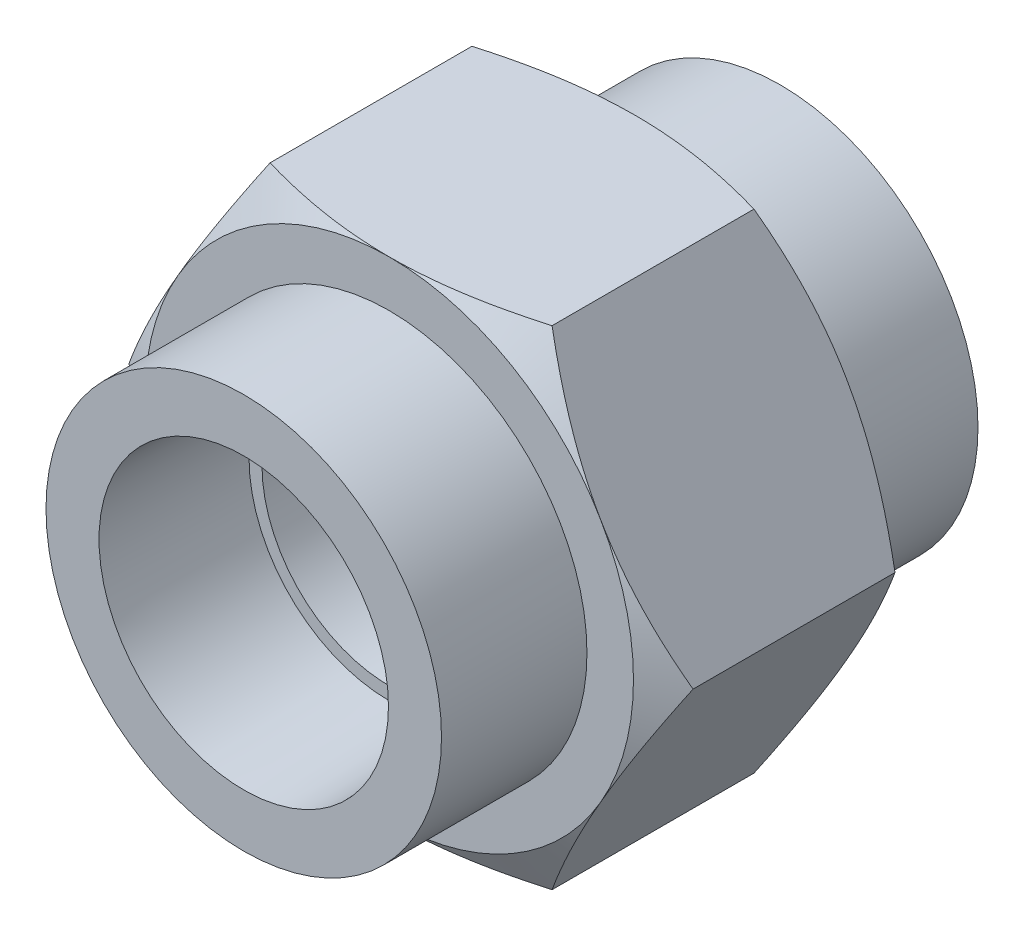
from build123d import *

# Parameters (mm, degrees)
BASE_DEPTH         = 30.95625
CUTSKETCH1_R       = 22.8203125
SIDECUT_DEPTH      = 16.78686
SKETCH4_R          = 16.7005
CUT_EXTRUDE2_DEPTH = 16.78686
CUT_EXTRUDE2_DRAFT = -1.783333333
SKETCH5_R          = 14.684375
CUT_EXTRUDE3_DEPTH = 30.95625


# Read off the part's stored shape, not the designer's step: Chamfer1, Mirror1
with BuildPart() as part:
    # BaseSketch → Base (new, symmetric)
    with BuildSketch(Plane.XY):
        Polygon((-16.273276599, 28.186141875), (16.273276599, 28.186141875), (32.546553198, 0), (16.273276599, -28.186141875), (-16.273276599, -28.186141875), (-32.546553198, 0), align=None)
    extrude(amount=BASE_DEPTH, both=True)

    # CutSketch1 → SideCut (cut)
    with BuildSketch(Plane.XY.offset(30.95625)):
        Polygon((16.273276599, -28.186141875), (32.546553198, 0), (16.273276599, 28.186141875), (-16.273276599, 28.186141875), (-32.546553198, 0), (-16.273276599, -28.186141875), align=None)
        Circle(CUTSKETCH1_R, mode=Mode.SUBTRACT)
    extrude(amount=-SIDECUT_DEPTH, mode=Mode.SUBTRACT)


with BuildPart() as cut_extrude2_tool:
    # Sketch4 → Cut-Extrude2 (with draft: the straight prism first)
    with BuildSketch(Plane(origin=(-0.730245843, 0.065793184, 30.95625), x_dir=(1, 0, 0), z_dir=(0, 0, 1))):
        with Locations((0.730245843, -0.065793184)):
            Circle(SKETCH4_R)
    extrude(amount=-CUT_EXTRUDE2_DEPTH)
    # Cut-Extrude2: the draft: its side faces are tilted about the plane it starts from
    cut_extrude2_sides = [cut_extrude2_tool.faces().sort_by_distance(p)[0] for p in [
        (-16.7005, 0, 22.56282),
    ]]
    draft(cut_extrude2_sides, Plane(origin=(-0.730245843, 0.065793184, 30.95625), x_dir=(1, 0, 0), z_dir=(0, 0, 1)), CUT_EXTRUDE2_DRAFT)


with BuildPart() as part_1:
    add(part.part)

    # Cut-Extrude2: cut by cut_extrude2_tool
    add(cut_extrude2_tool.part, mode=Mode.SUBTRACT)

    # Sketch5 → Cut-Extrude3 (cut)
    with BuildSketch(Plane.XY.offset(30.95625)):
        Circle(SKETCH5_R)
    extrude(amount=-CUT_EXTRUDE3_DEPTH, mode=Mode.SUBTRACT)

    # Cut-Extrude4 cone 1 section (through the dimple's axis) → Cut-Extrude4 (revolve, cut)
    with BuildSketch(Plane(origin=(0, 0, 0), x_dir=(0, -1, 0), z_dir=(1, 0, 0))):
        Polygon((0, 0), (14.684375, 0), (0, 8.478027859), align=None)
    revolve(axis=Axis((0, 0, 0), (0, 0, -1)), mode=Mode.SUBTRACT)

    # Chamfer1 outline → Chamfer1 (revolve, cut)
    with BuildSketch(Plane.XZ):
        Polygon((32.5465532, 14.16939023), (28.186141742, 14.16939023), (32.5465532, 11.651905348), align=None)
    revolve(axis=Axis((0, 0, 0), (0, 0, 1)), mode=Mode.SUBTRACT)

    # Mirror1 outline → Mirror1 (revolve, cut)
    with BuildSketch(Plane.XZ):
        Polygon((0, -30.95625), (16.7005, -30.95625), (16.177839549, -14.16939), (14.684375, -14.16939), (14.684375, 0), (0, -8.478027859), align=None)
        Polygon((22.8203125, -14.16939), (22.8203125, -30.95625), (32.5465532, -30.95625), (32.5465532, -11.651905348), (28.186141875, -14.16939), align=None)
    revolve(axis=Axis((0, 0, 0), (0, 0, 1)), mode=Mode.SUBTRACT)


solid = part_1.part
